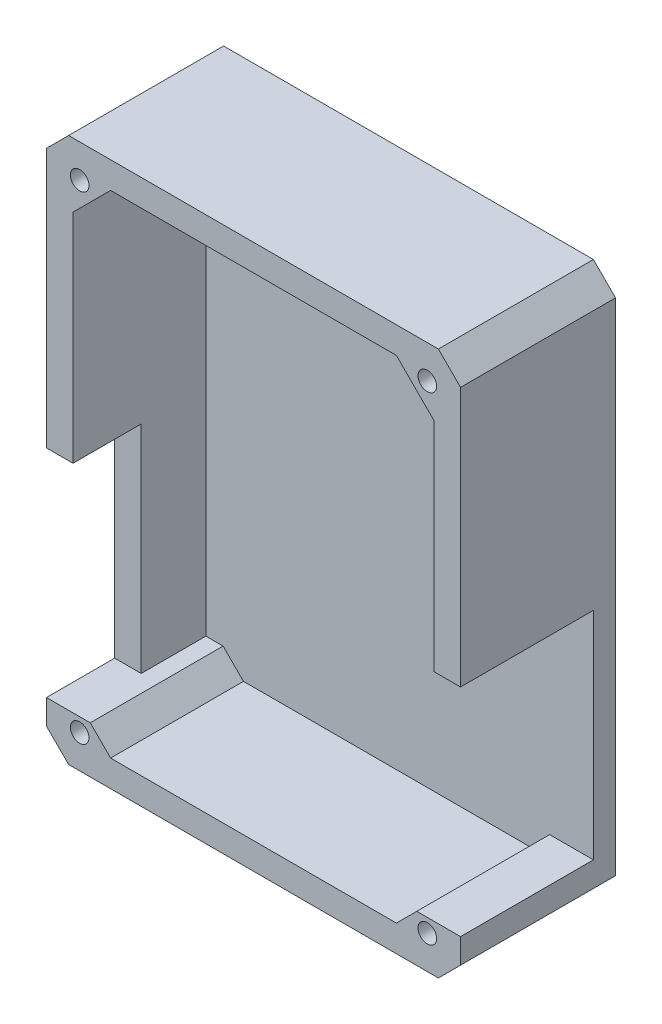
from build123d import *

# Parameters (mm, degrees)
SKETCH1_W           = 93.5
SKETCH1_H           = 123
BOSS_EXTRUDE1_DEPTH = 5
BOSS_EXTRUDE2_DEPTH = 30
CHAMFER1_SIZE       = 5
SKETCH4_W           = 6
SKETCH4_H           = 48.8
BOSS_EXTRUDE3_DEPTH = 14.6
SKETCH5_R           = 2.1
CUT_EXTRUDE1_DEPTH  = 3.5
SKETCH6_R           = 2.1
CUT_EXTRUDE2_DEPTH  = 3.5


with BuildPart() as part:
    # Sketch1 → Boss-Extrude1 (new body)
    with BuildSketch(Plane.XY):
        with Locations((0, 28.5)):
            Rectangle(SKETCH1_W, SKETCH1_H)
    extrude(amount=BOSS_EXTRUDE1_DEPTH)

    # Sketch3 → Boss-Extrude2 (add)
    with BuildSketch(Plane.XY.offset(5)):
        Polygon((-46.75, 90), (-46.75, 26.4), (-40.75, 26.4), (-40.75, 75.514718626), (-32.264718626, 84), (32.264718626, 84), (40.75, 75.514718626), (40.75, 26.4), (46.75, 26.4), (46.75, 90), align=None)
        Polygon((-46.75, -22.4), (-46.75, -33), (46.75, -33), (46.75, -22.4), (36.864718626, -22.4), (32.264718626, -27), (-32.264718626, -27), (-36.864718626, -22.4), align=None)
    extrude(amount=BOSS_EXTRUDE2_DEPTH)

    # Chamfer1
    chamfer1_edges = [part.edges().sort_by_distance(p)[0] for p in [
        (46.75, 90, 17.5),
        (46.75, -33, 17.5),
        (-46.75, -33, 17.5),
        (-46.75, 90, 17.5),
    ]]
    chamfer(chamfer1_edges, length=CHAMFER1_SIZE)

    # Sketch4 → Boss-Extrude3 (add)
    with BuildSketch(Plane.XY.offset(5)):
        with Locations((-43.75, 2)):
            Rectangle(SKETCH4_W, SKETCH4_H)
    extrude(amount=BOSS_EXTRUDE3_DEPTH)

    # Sketch5 → Cut-Extrude1 (cut)
    with BuildSketch(Plane.XY.offset(35)):
        with Locations((-39.25, 82.5)):
            Circle(SKETCH5_R)
        with Locations((-39.25, -25.5)):
            Circle(SKETCH5_R)
        with Locations((39.25, 82.5)):
            Circle(SKETCH5_R)
        with Locations((39.25, -25.5)):
            Circle(SKETCH5_R)
    extrude(amount=-CUT_EXTRUDE1_DEPTH, mode=Mode.SUBTRACT)

    # Sketch6 → Cut-Extrude2 (cut)
    with BuildSketch(Plane(origin=(0, 0, 0), x_dir=(-1, 0, 0), z_dir=(0, 0, -1))):
        with Locations((-33.307444613, -24)):
            Circle(SKETCH6_R)
        with Locations((-33.307444613, 32)):
            Circle(SKETCH6_R)
        with Locations((33.307444613, 32)):
            Circle(SKETCH6_R)
        with Locations((33.307444613, -24)):
            Circle(SKETCH6_R)
    extrude(amount=-CUT_EXTRUDE2_DEPTH, mode=Mode.SUBTRACT)


solid = part.part
